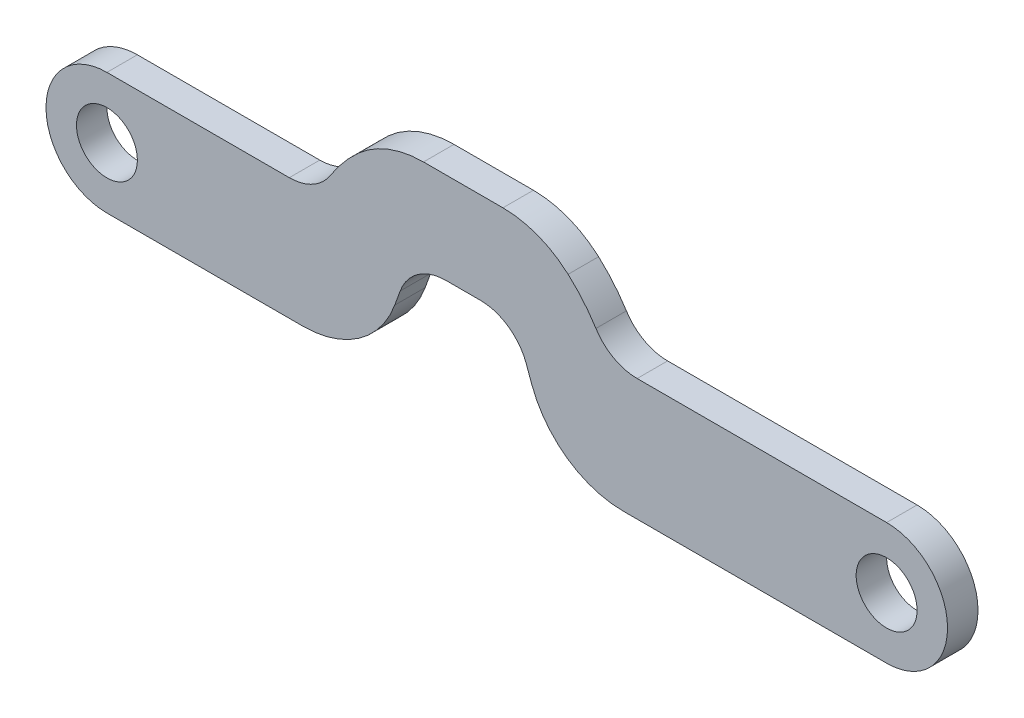
from build123d import *

# Parameters (mm, degrees)
SKETCH_1_R      = 1
EXTRUDE_1_DEPTH = 0.5
EXTRUDE1_DEPTH  = 0.5
EXTRUDE2_DEPTH  = 0.5
FILLET2_R       = 1.6
FILLET3_R       = 3.2


with BuildPart() as part:
    # Эскиз1 → Бобышка-Вытянуть1 (new, symmetric)
    with BuildSketch(Plane.XY):
        with BuildLine():
            Line((0, 2), (-25.5979, 2))
            ThreePointArc((-25.5979, 2), (-27.5979, 0), (-25.5979, -2))
            Line((-25.5979, -2), (0, -2))
            ThreePointArc((0, -2), (2, 0), (0, 2))
        make_face()
        with Locations((-25.5979, 0)):
            Circle(SKETCH_1_R, mode=Mode.SUBTRACT)
        Circle(SKETCH_1_R, mode=Mode.SUBTRACT)
    extrude(amount=EXTRUDE_1_DEPTH, both=True)

    # Sketch2 → Extrude1 (add, symmetric)
    with BuildSketch(Plane.XY):
        with BuildLine():
            Line((-13.9, 0), (-11.75, 0))
            ThreePointArc((-11.75, 0), (-11.782663331, 0.373343582), (-11.879660865, 0.735343308))
            Line((-11.879660865, 0.735343308), (-11.612017789, 0))
            Line((-11.612017789, 0), (-8.75, 0))
            ThreePointArc((-8.75, 0), (-14.920219052, 5.047935527), (-18.645787606, -2))
            Line((-18.645787606, -2), (-16.915922679, -2))
            Line((-16.915922679, -2), (-15.920339135, 0.735343308))
            ThreePointArc((-15.920339135, 0.735343308), (-15.860511069, -0.882551045), (-14.688986692, -2))
            Line((-14.688986692, -2), (-13.9, -2))
            Line((-13.9, -2), (-13.9, 0))
        make_face()
    extrude(amount=EXTRUDE1_DEPTH, both=True)

    # Sketch → Extrude2 (cut, symmetric)
    with BuildSketch(Plane.XY):
        with BuildLine():
            Line((-10.884077321, -2), (-11.879660865, 0.735343308))
            ThreePointArc((-11.879660865, 0.735343308), (-12.140166364, 1.235105491), (-12.521595125, 1.65))
            Line((-12.521595125, 1.65), (-15.278404875, 1.65))
            ThreePointArc((-15.278404875, 1.65), (-15.659833636, 1.235105491), (-15.920339135, 0.735343308))
            Line((-15.920339135, 0.735343308), (-16.915922679, -2))
            Line((-16.915922679, -2), (-10.884077321, -2))
        make_face()
        with BuildLine():
            ThreePointArc((-11.686405638, 4.65), (-13.9, 5.15), (-16.113594362, 4.65))
            Line((-16.113594362, 4.65), (-11.686405638, 4.65))
        make_face()
    extrude(amount=EXTRUDE2_DEPTH, both=True, mode=Mode.SUBTRACT)

    # Fillet2
    fillet2_edges = [part.edges().sort_by_distance(p)[0] for p in [
        (-9.154212394, 2, 0),
        (-18.645787606, 2, 0),
        (-12.521595125, 1.65, 0),
        (-15.278404875, 1.65, 0),
    ]]
    fillet(fillet2_edges, radius=FILLET2_R)

    # Fillet3
    fillet3_edges = [part.edges().sort_by_distance(p)[0] for p in [
        (-10.884077321, -2, 0),
        (-16.915922679, -2, 0),
        (-11.686405638, 4.65, 0),
        (-16.113594362, 4.65, 0),
    ]]
    fillet(fillet3_edges, radius=FILLET3_R)


solid = part.part
